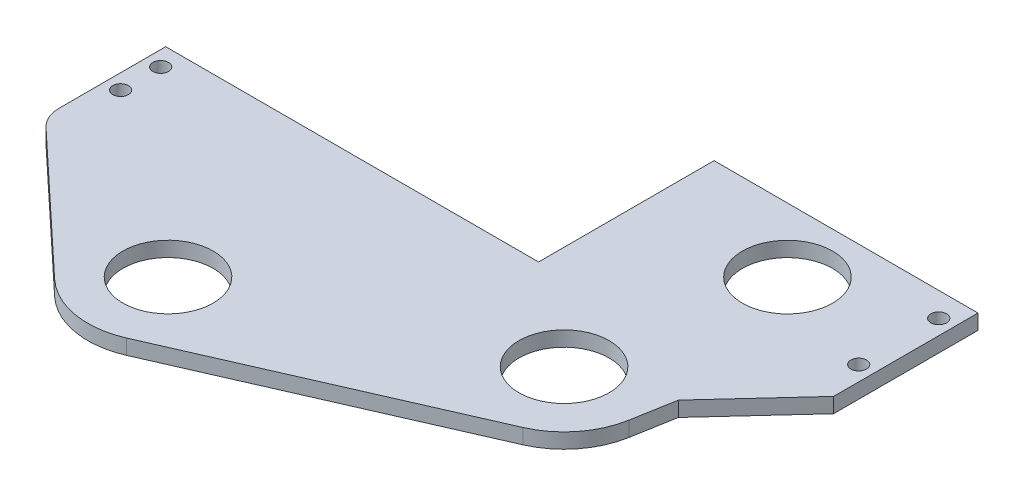
from build123d import *

# Parameters (mm, degrees)
SKETCH1_R              = 14.29004
BOSS_EXTRUDE1_DEPTH    = 4.7625
FILLET1_R              = 10
F_10_CLEARANCE_HOLE1_D = 4.9784


with BuildPart() as part:
    # Sketch1 → Boss-Extrude1 (new body)
    with BuildSketch(Plane(origin=(0, 0, 0), x_dir=(1, 0, 0), z_dir=(0, 1, 0))):
        with BuildLine():
            Line((-62.06952, -79.895280222), (25.163028109, -41.695780276))
            ThreePointArc((25.163028109, -41.695780276), (34.911191298, -34.148496119), (39.936134607, -22.890693115))
            Line((39.936134607, -22.890693115), (42.271095404, -9.586739751))
            Line((42.271095404, -9.586739751), (65.82695514, 16.012754812))
            Line((65.82695514, 16.012754812), (65.826833771, 61.726825209))
            Line((65.826833771, 61.726825209), (-17.734439664, 61.726825209))
            Line((-17.734439664, 61.726825209), (-17.734439664, 6.164335762))
            Line((-17.734439664, 6.164335762), (-135.78566057, 6.164335762))
            Line((-135.78566057, 6.164335762), (-135.78566057, -31.935664238))
            Line((-135.78566057, -31.935664238), (-89.620113812, -75.16814328))
            ThreePointArc((-89.620113812, -75.16814328), (-76.553580444, -81.662511553), (-62.06952, -79.895280222))
        make_face()
        with Locations((25.821833771, 41.412625209)):
            Circle(SKETCH1_R, mode=Mode.SUBTRACT)
        with Locations((15.012562201, -18.516537909)):
            Circle(SKETCH1_R, mode=Mode.SUBTRACT)
        with Locations((-72.258332946, -56.628468385)):
            Circle(SKETCH1_R, mode=Mode.SUBTRACT)
    extrude(amount=BOSS_EXTRUDE1_DEPTH)

    # Fillet1
    fillet1_edges = [part.edges().sort_by_distance(p)[0] for p in [
        (-135.78566057, 2.38125, 31.935664238),
    ]]
    fillet(fillet1_edges, radius=FILLET1_R)

    # #10 Clearance Hole1 (through all)
    with Locations(Plane(origin=(0, 4.7625, 0), x_dir=(1, 0, 0), z_dir=(0, 1, 0))):
        with Locations((61.064354133, 54.057452946), (61.064421422, 28.712718776), (-131.02316057, -0.185664238), (-131.02316057, -12.885664238)):
            Hole(F_10_CLEARANCE_HOLE1_D / 2)


solid = part.part
